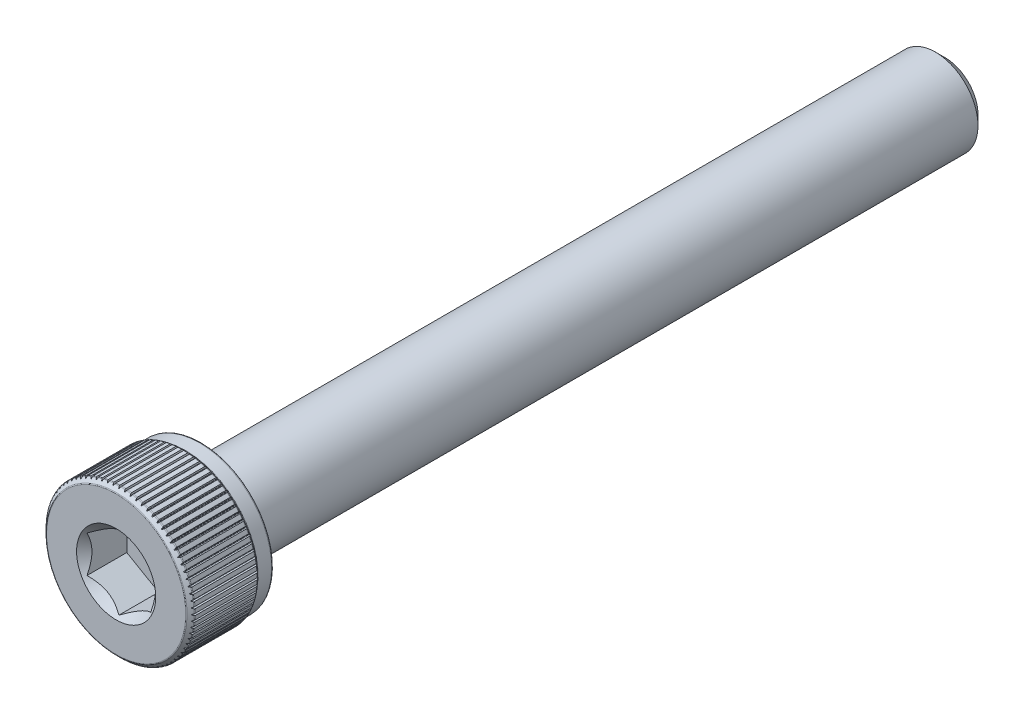
from build123d import *

# Parameters (mm, degrees)
CUT_EXTRUDE1_START = -2
CUT_EXTRUDE1_DEPTH = 2
CUT_EXTRUDE3_DEPTH = 40.312847791
CIRPATTERN1_COUNT  = 80


with BuildPart() as part:
    # Sketch2 → Revolve1 (revolve)
    with BuildSketch(Plane(origin=(0, 0, 0), x_dir=(0, 0, -1), z_dir=(1, 0, 0))):
        with BuildLine():
            Line((-19.5, 0), (-19.5, 3.274111652))
            ThreePointArc((-19.5, 3.274111652), (-19.495242471, 3.298029367), (-19.481694174, 3.318305826))
            Line((-19.481694174, 3.318305826), (-19.318305826, 3.481694174))
            ThreePointArc((-19.318305826, 3.481694174), (-19.298029367, 3.495242471), (-19.274111652, 3.5))
            Line((-19.274111652, 3.5), (-16.375888348, 3.5))
            ThreePointArc((-16.375888348, 3.5), (-16.351970633, 3.495242471), (-16.331694174, 3.481694174))
            Line((-16.331694174, 3.481694174), (-16.268305826, 3.418305826))
            ThreePointArc((-16.268305826, 3.418305826), (-16.248029367, 3.404757529), (-16.224111652, 3.4))
            Line((-16.224111652, 3.4), (-15.5875, 3.4))
            ThreePointArc((-15.5875, 3.4), (-15.525628157, 3.374371843), (-15.5, 3.3125))
            Line((-15.5, 3.3125), (-15.5, 2.2))
            ThreePointArc((-15.5, 2.2), (-15.441421356, 2.058578644), (-15.3, 2))
            Line((-15.3, 2), (19.045336663, 2))
            Line((19.045336663, 2), (19.5, 1.545336663))
            Line((19.5, 1.545336663), (19.5, 0))
            Line((19.5, 0), (-19.5, 0))
        make_face()
    revolve(axis=Axis((0, 0, -19.5), (0, 0, 1)))

    # Sketch3 → Cut-Extrude1 (cut)
    with BuildSketch(Plane.XY.offset(19.5).offset(CUT_EXTRUDE1_START)):
        Polygon((1.5, -0.866025404), (1.5, 0.866025404), (0, 1.732050808), (-1.5, 0.866025404), (-1.5, -0.866025404), (0, -1.732050808), align=None)
    extrude(amount=CUT_EXTRUDE1_DEPTH, mode=Mode.SUBTRACT)

    # Cut-Extrude2 cone 1 section (through the dimple's axis) → Cut-Extrude2 (revolve, cut)
    with BuildSketch(Plane(origin=(0, 0, 19.5), x_dir=(0, -1, 0), z_dir=(1, 0, 0))):
        Polygon((0, 0), (1.861954618, 0), (0, 1.861954618), align=None)
    revolve(axis=Axis((0, 0, 19.5), (0, 0, -1)), mode=Mode.SUBTRACT)

    # Sketch9 → Cut-Extrude3 (cut, through all)
    with BuildSketch(Plane.XY.offset(19.5)):
        with BuildLine():
            Line((-0.015971432, 3.435662204), (-0.0875, 3.595376524))
            Line((-0.0875, 3.595376524), (0.0875, 3.595376524))
            Line((0.0875, 3.595376524), (0.015971432, 3.435662204))
            ThreePointArc((0.015971432, 3.435662204), (0, 3.425315061), (-0.015971432, 3.435662204))
        make_face()
    cut_extrude3 = extrude(amount=-CUT_EXTRUDE3_DEPTH, mode=Mode.SUBTRACT)

    # CirPattern1: Cut-Extrude3 ×80 about axis
    cirpattern1_axis = Axis((0, 0, 0), (0, 0, 1))
    for i in range(1, CIRPATTERN1_COUNT):
        add(cut_extrude3.rotate(cirpattern1_axis, i * 360 / CIRPATTERN1_COUNT), mode=Mode.SUBTRACT)


solid = part.part
